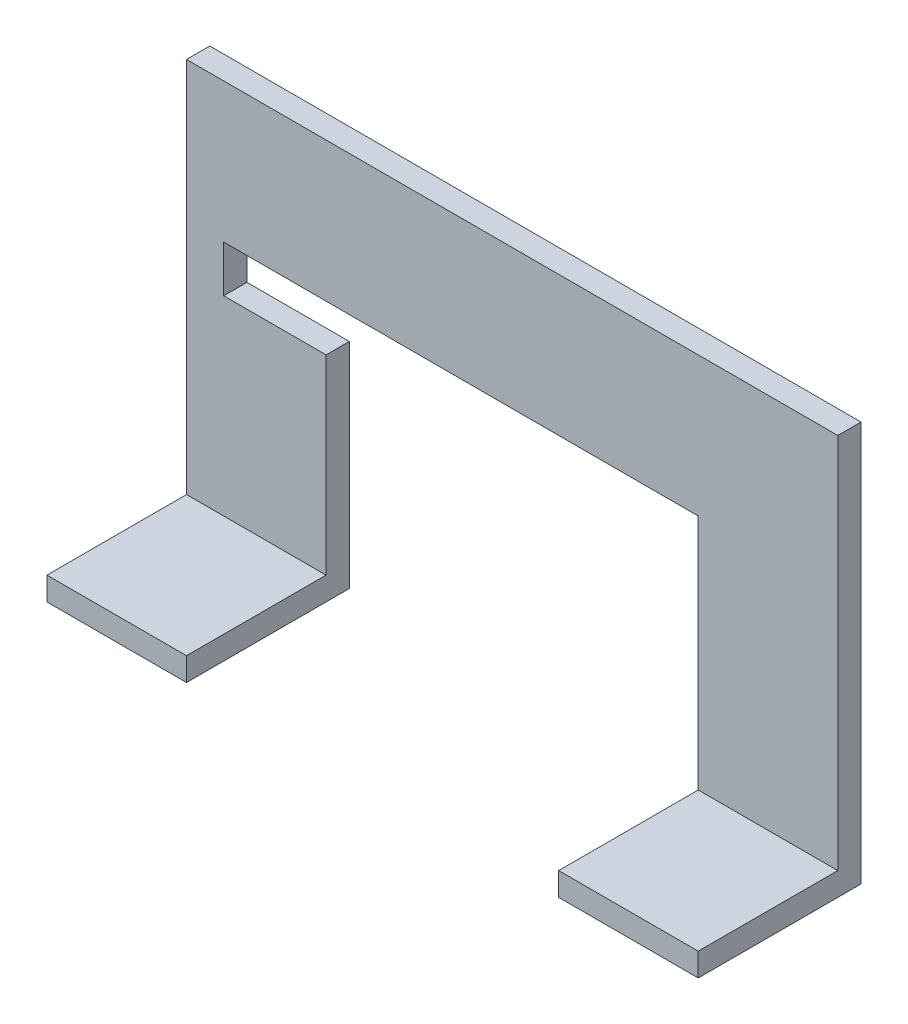
from build123d import *

# Parameters (mm, degrees)
BASE_FLANGE1_DEPTH  = 2.5
SKETCH6_W           = 15
SKETCH6_H           = 2.5
BOSS_EXTRUDE1_DEPTH = 15


# Sheet-metal steps are written as plain solids
with BuildPart() as part:
    # Sketch1 → Base-Flange1 (new body)
    with BuildSketch(Plane.XY):
        Polygon((-35, 0), (35, 0), (35, -43), (20, -43), (20, -15), (-31, -15), (-31, -20), (-20, -20), (-20, -43), (-35, -43), align=None)
    extrude(amount=-BASE_FLANGE1_DEPTH)

    # Sketch6 → Boss-Extrude1 (add)
    with BuildSketch(Plane.XY):
        with Locations((-27.5, -41.75)):
            Rectangle(SKETCH6_W, SKETCH6_H)
    boss_extrude1 = extrude(amount=BOSS_EXTRUDE1_DEPTH)

    # Mirror1: Boss-Extrude1 across plane
    add(boss_extrude1.mirror(Plane(origin=(0, 0, 0), x_dir=(0, 0, 1), z_dir=(1, 0, 0))))


solid = part.part
